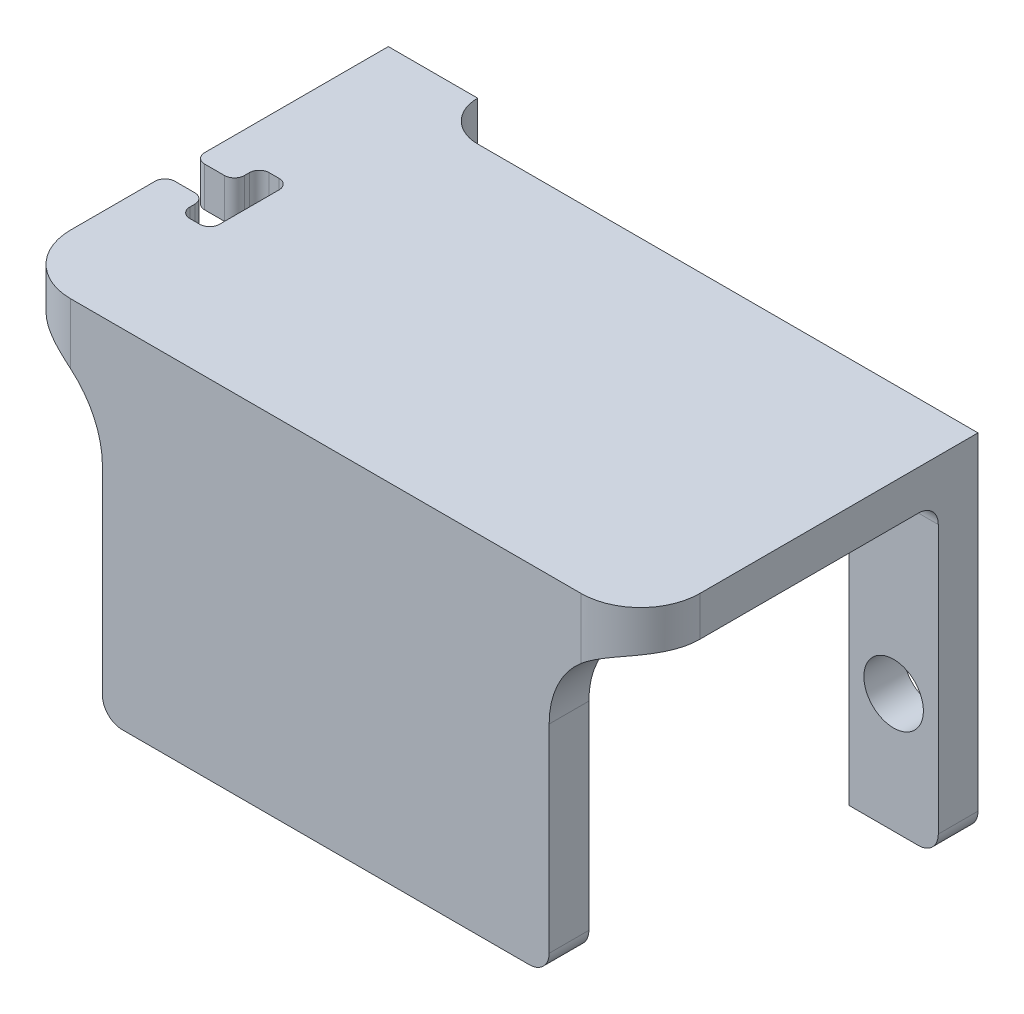
from build123d import *

# Parameters (mm, degrees)
SKETCH_1_W          = 4.5
SKETCH_1_H          = 12
EXTRUDE_1_DEPTH     = 2
EXTRUDE_1_2_DEPTH   = 2
SKETCH_2_W          = 4.5
SKETCH_2_H          = 12
EXTRUDE_4_DEPTH     = 2
SKETCH_4_R          = 1.5
CUT_EXTRUDE_1_DEPTH = 18.413285158
SKETCH_5_W          = 31.7
SKETCH_5_H          = 5.5
EXTRUDE_5_DEPTH     = 2
SKETCH_6_W          = 31.7
SKETCH_6_H          = 2
EXTRUDE_6_DEPTH     = 15
SKETCH_7_W          = 22.5
SKETCH_7_H          = 2
EXTRUDE_7_DEPTH     = 15.5
FILLET_3_R          = 1
FILLET_4_R          = 4.5
FILLET_5_R          = 1
FILLET_6_R          = 3
SKETCH_8_W          = 4.5
SKETCH_8_H          = 2
EXTRUDE_8_DEPTH     = 5.5
FILLET_7_R          = 2
CUT_EXTRUDE_2_DEPTH = 28.936938031
FILLET_8_R          = 0.5


with BuildPart() as part:
    # 草图1 → 凸台-拉伸1 (new body)
    with BuildSketch(Plane.XY):
        with Locations((13.6, 0)):
            Rectangle(SKETCH_1_W, SKETCH_1_H)
    extrude(amount=EXTRUDE_1_DEPTH)


with BuildPart() as body_2:
    # 草图1 → Extrude 1 2 (new body)
    with BuildSketch(Plane.XY):
        with Locations((-13.6, 0)):
            Rectangle(SKETCH_1_W, SKETCH_1_H)
    extrude(amount=EXTRUDE_1_2_DEPTH)

    # 草图2 → 凸台-拉伸4 (add)
    with BuildSketch(Plane.XY):
        with Locations((-13.6, 0)):
            Rectangle(SKETCH_2_W, SKETCH_2_H)
    extrude(amount=-EXTRUDE_4_DEPTH)


with BuildPart() as cut_extrude_1_tool:
    # 草图4 → 切除-拉伸1 (new, through all)
    with BuildSketch(Plane(origin=(0, 0, 2), x_dir=(-1, 0, 0), z_dir=(0, 0, -1))):
        with Locations((13.6, 0)):
            Circle(SKETCH_4_R)
        with Locations(Location((-13.6, 0, 0), (0, 0, 180))):
            Circle(SKETCH_4_R)
    extrude(amount=CUT_EXTRUDE_1_DEPTH)


with BuildPart() as part_1:
    add(part.part)

    # 切除-拉伸1: cut by cut_extrude_1_tool
    add(cut_extrude_1_tool.part, mode=Mode.SUBTRACT)



with BuildPart() as body_2_1:
    add(body_2.part)

    # 切除-拉伸1: cut by cut_extrude_1_tool
    add(cut_extrude_1_tool.part, mode=Mode.SUBTRACT)


with BuildPart() as part_2:
    add(part_1.part)

    add(body_2_1.part)  # 凸台-拉伸5 merges body 2
    # 草图5 → 凸台-拉伸5 (add)
    with BuildSketch(Plane.XY.offset(2)):
        with Locations((0, 8.75)):
            Rectangle(SKETCH_5_W, SKETCH_5_H)
    extrude(amount=-EXTRUDE_5_DEPTH)

    # 草图6 → 凸台-拉伸6 (add)
    with BuildSketch(Plane.XY.offset(2)):
        with Locations((0, 10.5)):
            Rectangle(SKETCH_6_W, SKETCH_6_H)
    extrude(amount=EXTRUDE_6_DEPTH)

    # 草图7 → 凸台-拉伸7 (add)
    with BuildSketch(Plane.XZ.offset(-9.5)):
        with Locations((0, 16)):
            Rectangle(SKETCH_7_W, SKETCH_7_H)
    extrude(amount=EXTRUDE_7_DEPTH)

    # 圆角3
    fillet_3_edges = [part_2.edges().sort_by_distance(p)[0] for p in [
        (-15.85, -6, 0),
        (15.85, -6, 1),
        (11.25, -6, 16),
        (-11.25, -6, 16),
    ]]
    fillet(fillet_3_edges, radius=FILLET_3_R)

    # 圆角4
    fillet_4_edges = [part_2.edges().sort_by_distance(p)[0] for p in [
        (11.25, 9.5, 16),
        (-11.25, 9.5, 16),
    ]]
    fillet(fillet_4_edges, radius=FILLET_4_R)

    # 圆角5
    fillet_5_edges = [part_2.edges().sort_by_distance(p)[0] for p in [
        (0, 9.5, 2),
        (0, 9.5, 15),
    ]]
    fillet(fillet_5_edges, radius=FILLET_5_R)

    # 圆角6
    fillet_6_edges = [part_2.edges().sort_by_distance(p)[0] for p in [
        (15.85, 10.5, 17),
        (-15.85, 10.5, 17),
    ]]
    fillet(fillet_6_edges, radius=FILLET_6_R)

    # 草图8 → 凸台-拉伸8 (add)
    with BuildSketch(Plane(origin=(0, 6, 0), x_dir=(1, 0, 0), z_dir=(0, 1, 0))):
        with Locations((-13.6, 1)):
            Rectangle(SKETCH_8_W, SKETCH_8_H)
    extrude(amount=EXTRUDE_8_DEPTH)

    # 圆角7
    fillet_7_edges = [part_2.edges().sort_by_distance(p)[0] for p in [
        (-11.35, 8.75, 0),
    ]]
    fillet(fillet_7_edges, radius=FILLET_7_R - 0.0001)  # a hair under: the kernel refuses the full size

    # 草图9 → 切除-拉伸2 (cut, through all)
    with BuildSketch(Plane.XZ.offset(-9.5)):
        Polygon((-15.85, 9.25), (-13.85, 9.25), (-13.85, 10.5), (-12.35, 10.5), (-12.35, 6.5), (-13.85, 6.5), (-13.85, 7.75), (-15.85, 7.75), align=None)
    extrude(amount=-CUT_EXTRUDE_2_DEPTH, mode=Mode.SUBTRACT)

    # 圆角8
    fillet_8_edges = [part_2.edges().sort_by_distance(p)[0] for p in [
        (-15.85, 10.5, 7.75),
        (-15.85, 10.5, 9.25),
        (-13.85, 10.5, 9.25),
        (-13.85, 10.5, 10.5),
        (-12.35, 10.5, 10.5),
        (-12.35, 10.5, 6.5),
        (-13.85, 10.5, 6.5),
        (-13.85, 10.5, 7.75),
    ]]
    fillet(fillet_8_edges, radius=FILLET_8_R)


solid = part_2.part
